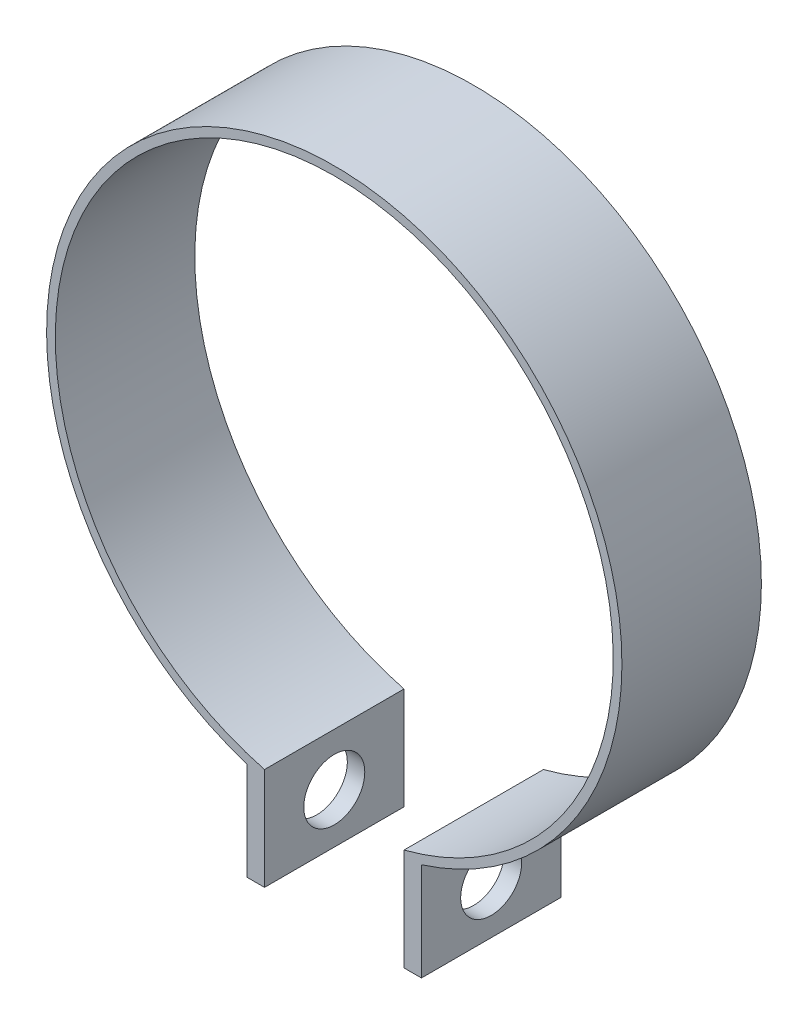
from build123d import *

# Parameters (mm, degrees)
SALIENTE_EXTRUIR1_DEPTH    = 8
CORTAR_EXTRUIR1_DEPTH      = 12
CORTAR_EXTRUIR1_DEPTH_BACK = 8
CROQUIS3_R                 = 1.75


with BuildPart() as part:
    # Croquis1 → Saliente-Extruir1 (new body)
    with BuildSketch(Plane.XY):
        with BuildLine():
            Line((-4, -21.348236246), (-4, -15.491933385))
            ThreePointArc((-4, -15.491933385), (0, 16), (4, -15.491933385))
            Line((4, -15.491933385), (4, -21.348236246))
            Line((4, -21.348236246), (5, -21.348236246))
            Line((5, -21.348236246), (5, -15.724185194))
            ThreePointArc((5, -15.724185194), (0, 16.5), (-5, -15.724185194))
            Line((-5, -15.724185194), (-5, -21.348236246))
            Line((-5, -21.348236246), (-4, -21.348236246))
        make_face()
    extrude(amount=SALIENTE_EXTRUIR1_DEPTH)

    # Croquis3 → Cortar-Extruir1 (cut, two sides: drawn at the far end of the back side and taken through both)
    with BuildSketch(Plane(origin=(-4, 0, 0), x_dir=(0, 0, -1), z_dir=(1, 0, 0)).offset(-CORTAR_EXTRUIR1_DEPTH_BACK)):
        with Locations((-4, -18.491933385)):
            Circle(CROQUIS3_R)
    extrude(amount=CORTAR_EXTRUIR1_DEPTH + CORTAR_EXTRUIR1_DEPTH_BACK, mode=Mode.SUBTRACT)


solid = part.part
